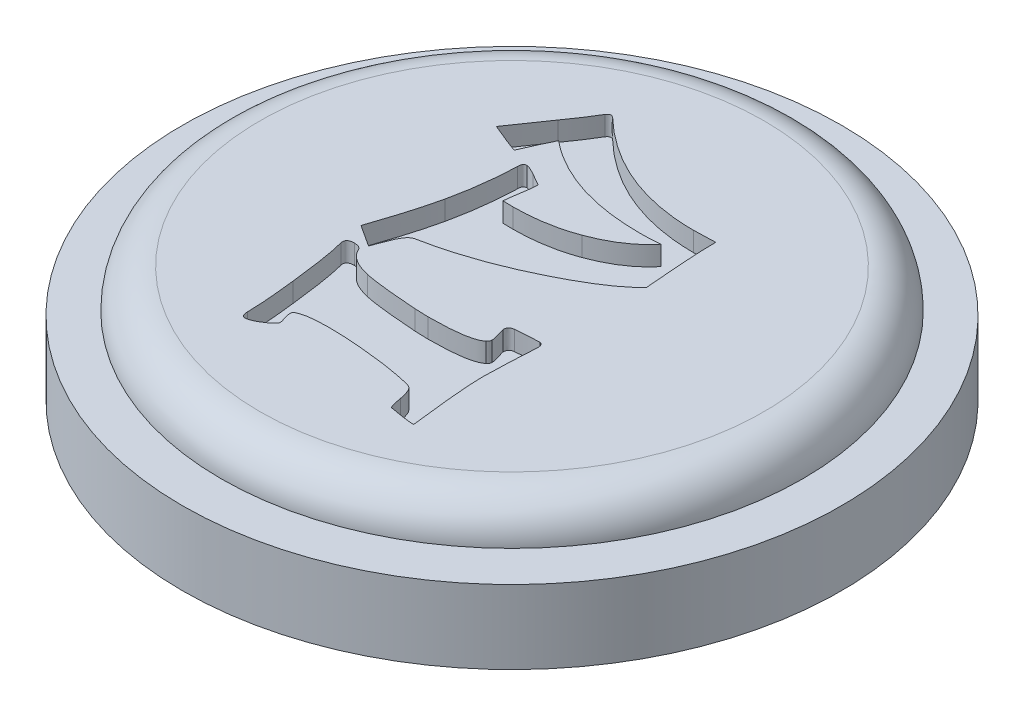
from build123d import *

# Parameters (mm, degrees)
SKETCH1_R           = 12.3
BOSS_EXTRUDE1_DEPTH = 4
SKETCH2_R           = 15
BOSS_EXTRUDE2_DEPTH = 2
CHAMFER1_SIZE       = 0.5
CHAMFER1_SIZE2      = 1.37373871
SKETCH4_R           = 16
SKETCH4_R_2         = 12.8
BOSS_EXTRUDE4_DEPTH = 3.6
FILLET1_R           = 2
CUT_EXTRUDE1_START  = -1
CUT_EXTRUDE1_DEPTH  = 1
SKETCH5_R           = 17
SKETCH5_R_2         = 13.3
BOSS_EXTRUDE5_DEPTH = 3.8


# Read off the part's stored shape, not the designer's step: Cut-Extrude1
with BuildPart() as part:
    # Sketch1 → Boss-Extrude1 (new body)
    with BuildSketch(Plane(origin=(0, 0, 0), x_dir=(1, 0, 0), z_dir=(0, 1, 0))):
        with Locations(Location((0, 0, 0), (0, 0, 270))):
            Circle(SKETCH1_R)
    extrude(amount=BOSS_EXTRUDE1_DEPTH)

    # Sketch2 → Boss-Extrude2 (add)
    with BuildSketch(Plane(origin=(0, 4, 0), x_dir=(1, 0, 0), z_dir=(0, 1, 0))):
        with Locations(Location((0, 0, 0), (0, 0, 270))):
            Circle(SKETCH2_R)
    extrude(amount=BOSS_EXTRUDE2_DEPTH)

    # Chamfer1
    chamfer1_edges = [part.edges().sort_by_distance(p)[0] for p in [
        (0, 0, -12.3),
    ]]
    chamfer1_side = [part.faces().sort_by_distance(p)[0] for p in [
        (0, 0, 0),
    ]]
    chamfer(chamfer1_edges, length=CHAMFER1_SIZE, length2=CHAMFER1_SIZE2, reference=chamfer1_side[0])

    # Fillet1
    fillet1_edges = [part.edges().sort_by_distance(p)[0] for p in [
        (0, 6, -15),
    ]]
    fillet(fillet1_edges, radius=FILLET1_R - 0.0001)  # a hair under: the kernel refuses the full size

    # Cut-Extrude1 outline → Cut-Extrude1 (cut)
    with BuildSketch(Plane(origin=(0, 6, 0), x_dir=(1, 0, 0), z_dir=(0, 1, 0)).offset(CUT_EXTRUDE1_START)):
        with BuildLine():
            add(Edge.make_bspline(
                [(2.881003751, -2.752911208), (3.001661354, -2.741591605), (3.231295855, -2.720048235), (3.55759474, -2.695693934), (3.847669077, -2.682942971), (4.028496236, -2.679784273), (4.1128087, -2.678311499)],
                knots=[0, 0, 0, 0, 0.294505446, 0.560500206, 0.795078845, 1, 1, 1, 1], degree=3))
            add(Edge.make_bspline(
                [(2.598980461, -3.051310044), (2.601892042, -3.010576786), (2.607324749, -2.934572771), (2.663465353, -2.834127629), (2.761830391, -2.771579045), (2.838830629, -2.75951739), (2.881003751, -2.752911208)],
                knots=[0, 0, 0, 0, 0.264788379, 0.494067532, 0.722900182, 1, 1, 1, 1], degree=3))
            add(Edge.make_bspline(
                [(2.786389486, -3.817321689), (2.785247921, -3.789346761), (2.782722007, -3.727447252), (2.762283461, -3.627925755), (2.733396505, -3.513119327), (2.694012176, -3.390810187), (2.655904598, -3.273675389), (2.627021829, -3.175380672), (2.607006365, -3.10468152), (2.601176485, -3.065913388), (2.598980461, -3.051310044)],
                knots=[0, 0, 0, 0, 0.106053365, 0.234661961, 0.384202293, 0.555208206, 0.7218246, 0.851396723, 0.944023487, 1, 1, 1, 1], degree=3))
            add(Edge.make_bspline(
                [(2.675399675, -4.015647744), (2.70786199, -3.984687529), (2.765698347, -3.929527383), (2.780079964, -3.851537508), (2.786389486, -3.817321689)],
                knots=[0, 0, 0, 0, 0.561278696, 1, 1, 1, 1], degree=3))
            add(Edge.make_bspline(
                [(0.091702441, -4.42503639), (0.25910651, -4.423384492), (0.577038055, -4.42024723), (1.028691827, -4.403885536), (1.429192979, -4.370583642), (1.778837259, -4.329557875), (2.077388488, -4.27269195), (2.323494502, -4.201788529), (2.524830315, -4.125745257), (2.628641621, -4.049837604), (2.675399675, -4.015647744)],
                knots=[0, 0, 0, 0, 0.189541194, 0.359974074, 0.511546566, 0.64441348, 0.758477424, 0.854968798, 0.934675933, 1, 1, 1, 1], degree=3))
            add(Edge.make_bspline(
                [(-0.59788999, -4.401382824), (-0.474805351, -4.408510004), (-0.245120695, -4.421809827), (-0.015068265, -4.424013591), (0.091702441, -4.42503639)],
                knots=[0, 0, 0, 0, 0.535885341, 1, 1, 1, 1], degree=3))
            add(Edge.make_bspline(
                [(-3.368996249, -4.084788937), (-3.313357802, -4.098894864), (-3.185485383, -4.131314152), (-2.965332908, -4.165636846), (-2.695716858, -4.206876752), (-2.374637366, -4.245820689), (-2.002904706, -4.286110571), (-1.579290394, -4.322903041), (-1.105715159, -4.363621585), (-0.772591158, -4.388392265), (-0.59788999, -4.401382824)],
                knots=[0, 0, 0, 0, 0.061653237, 0.141696055, 0.239217594, 0.354821433, 0.489201033, 0.641029359, 0.811744005, 1, 1, 1, 1], degree=3))
            add(Edge.make_bspline(
                [(-4.675400907, -3.26419214), (-4.65035264, -3.312553436), (-4.599837959, -3.410083353), (-4.491785781, -3.539854027), (-4.364421043, -3.661768236), (-4.208846624, -3.767325221), (-4.033959055, -3.86698803), (-3.833205442, -3.951601863), (-3.609814804, -4.025974884), (-3.451196426, -4.064713551), (-3.368996249, -4.084788937)],
                knots=[0, 0, 0, 0, 0.102065057, 0.205833946, 0.315482163, 0.432472068, 0.558004546, 0.693288222, 0.841053963, 1, 1, 1, 1], degree=3))
            add(Edge.make_bspline(
                [(-5.097526089, -3.027656477), (-5.048652774, -3.030064334), (-4.957088821, -3.034575444), (-4.831534074, -3.077808164), (-4.733420891, -3.156912741), (-4.69500808, -3.227938327), (-4.675400907, -3.26419214)],
                knots=[0, 0, 0, 0, 0.284392406, 0.532808, 0.761529718, 1, 1, 1, 1], degree=3))
            add(Edge.make_bspline(
                [(-5.459607603, -3.355167394), (-5.463054998, -3.329767341), (-5.469543319, -3.281962053), (-5.463329309, -3.212814496), (-5.438991475, -3.153814779), (-5.398395111, -3.106409827), (-5.343914731, -3.069364367), (-5.274588184, -3.044416324), (-5.190868036, -3.030614089), (-5.130334097, -3.028696025), (-5.097526089, -3.027656477)],
                knots=[0, 0, 0, 0, 0.131741991, 0.247950816, 0.352917975, 0.454869288, 0.56487117, 0.688400872, 0.831120413, 1, 1, 1, 1], degree=3))
            add(Edge.make_bspline(
                [(-4.984716773, -6.308224163), (-5.003792254, -6.144428402), (-5.040550562, -5.828795211), (-5.099100734, -5.372723587), (-5.156891853, -4.951728896), (-5.214689589, -4.564576843), (-5.274458994, -4.212785822), (-5.334704553, -3.89558441), (-5.393065766, -3.612912527), (-5.438351343, -3.437502025), (-5.459607603, -3.355167394)],
                knots=[0, 0, 0, 0, 0.16527492, 0.31848352, 0.460845698, 0.591174989, 0.71079668, 0.818452341, 0.914784695, 1, 1, 1, 1], degree=3))
            add(Edge.make_bspline(
                [(-4.782751708, -8.864628821), (-4.783691054, -8.793055999), (-4.785697706, -8.640160683), (-4.794879926, -8.396255277), (-4.81221185, -8.122170635), (-4.833942375, -7.817688154), (-4.860989732, -7.482803742), (-4.895904707, -7.118298675), (-4.938229599, -6.723568294), (-4.96883372, -6.450132832), (-4.984716773, -6.308224163)],
                knots=[0, 0, 0, 0, 0.083701485, 0.178804811, 0.285381045, 0.404835718, 0.535767461, 0.678252657, 0.83301823, 1, 1, 1, 1], degree=3))
            add(Edge.make_bspline(
                [(-4.573508622, -9.199417758), (-4.605277031, -9.195493362), (-4.667638644, -9.187789744), (-4.741386158, -9.112757623), (-4.778131917, -8.999997263), (-4.781085388, -8.913455079), (-4.782751708, -8.864628821)],
                knots=[0, 0, 0, 0, 0.211364709, 0.414910434, 0.669898164, 1, 1, 1, 1], degree=3))
            add(Edge.make_bspline(
                [(-3.467249524, -8.475254731), (-3.468915985, -8.490008021), (-3.472453142, -8.521322726), (-3.495300046, -8.568742476), (-3.53040511, -8.618797688), (-3.57776, -8.67404839), (-3.641577911, -8.729287282), (-3.715083671, -8.79224699), (-3.80584531, -8.854391544), (-3.935103215, -8.943875642), (-4.09702244, -9.03902317), (-4.276521615, -9.128601328), (-4.43262425, -9.184669614), (-4.53013484, -9.194877278), (-4.573508622, -9.199417758)],
                knots=[0, 0, 0, 0, 0.032229403, 0.068408758, 0.113231059, 0.165816983, 0.226763914, 0.297317821, 0.377081524, 0.466726126, 0.640741107, 0.786479442, 0.905023708, 1, 1, 1, 1], degree=3))
            add(Edge.make_bspline(
                [(-3.618268447, -7.834788937), (-3.61665676, -7.852401472), (-3.612800252, -7.894545429), (-3.599874615, -7.967181778), (-3.574752679, -8.058380755), (-3.544105671, -8.161811825), (-3.512124261, -8.264298374), (-3.488956846, -8.35297292), (-3.472463756, -8.420741073), (-3.46876249, -8.459437003), (-3.467249524, -8.475254731)],
                knots=[0, 0, 0, 0, 0.080451376, 0.192507176, 0.335067377, 0.510569865, 0.683427478, 0.823318736, 0.927778035, 1, 1, 1, 1], degree=3))
            add(Edge.make_bspline(
                [(-3.558224779, -7.691048035), (-3.567253185, -7.696526263), (-3.586907282, -7.708451915), (-3.606546297, -7.741583023), (-3.616617616, -7.785035983), (-3.617682569, -7.817131667), (-3.618268447, -7.834788937)],
                knots=[0, 0, 0, 0, 0.190545164, 0.414801129, 0.67805593, 1, 1, 1, 1], degree=3))
            add(Edge.make_bspline(
                [(-2.017103964, -7.452692868), (-2.106881472, -7.453318081), (-2.279835902, -7.454522543), (-2.528002665, -7.465652099), (-2.75467792, -7.482345977), (-2.958306435, -7.510924214), (-3.140836414, -7.540962589), (-3.299839027, -7.584831747), (-3.439590969, -7.628418205), (-3.520491306, -7.671127567), (-3.558224779, -7.691048035)],
                knots=[0, 0, 0, 0, 0.17117688, 0.329768563, 0.47363951, 0.604323439, 0.721831521, 0.825903215, 0.918797911, 1, 1, 1, 1], degree=3))
            add(Edge.make_bspline(
                [(1.039664595, -7.68558952), (0.895971073, -7.667010818), (0.613648635, -7.630508237), (0.196329167, -7.583210738), (-0.206436171, -7.54327584), (-0.595821826, -7.510093026), (-0.970704838, -7.484743901), (-1.332222975, -7.466382783), (-1.679207547, -7.454933584), (-1.906106023, -7.453428936), (-2.017103964, -7.452692868)],
                knots=[0, 0, 0, 0, 0.141687778, 0.278381645, 0.410696119, 0.537477972, 0.660531372, 0.778116023, 0.891455135, 1, 1, 1, 1], degree=3))
            add(Edge.make_bspline(
                [(2.748179879, -8.065866084), (2.729688804, -8.05375144), (2.681071963, -8.021899547), (2.577522803, -7.985048227), (2.430713571, -7.944842949), (2.239318088, -7.899870106), (2.003346649, -7.850807183), (1.722315921, -7.798920394), (1.396028004, -7.742345169), (1.163441223, -7.705302607), (1.039664595, -7.68558952)],
                knots=[0, 0, 0, 0, 0.037657184, 0.099008487, 0.186216267, 0.298004238, 0.43450404, 0.597822424, 0.785971566, 1, 1, 1, 1], degree=3))
            add(Edge.make_bspline(
                [(3.033842179, -8.797307132), (3.018011424, -8.714354269), (2.988679328, -8.56065462), (2.923291163, -8.355440497), (2.850842907, -8.1877438), (2.780372279, -8.104083701), (2.748179879, -8.065866084)],
                knots=[0, 0, 0, 0, 0.318086781, 0.589368758, 0.812415385, 1, 1, 1, 1], degree=3))
            add(Edge.make_bspline(
                [(3.217612193, -9.426855895), (3.210564808, -9.421113651), (3.192460575, -9.406362233), (3.173035093, -9.367846074), (3.151178165, -9.315139549), (3.130169548, -9.244628141), (3.10605428, -9.15756874), (3.083711462, -9.052126354), (3.057485084, -8.930495039), (3.042035257, -8.843461317), (3.033842179, -8.797307132)],
                knots=[0, 0, 0, 0, 0.040805156, 0.104825552, 0.190971929, 0.300353499, 0.436852968, 0.600004338, 0.787881375, 1, 1, 1, 1], degree=3))
            add(Edge.make_bspline(
                [(4.533114377, -9.6069869), (4.499753884, -9.605887418), (4.426313835, -9.60346701), (4.307222754, -9.596861887), (4.170248136, -9.581098722), (4.014982288, -9.561012395), (3.841470823, -9.535693376), (3.64928719, -9.504197887), (3.439347836, -9.468249264), (3.293389592, -9.441001938), (3.217612193, -9.426855895)],
                knots=[0, 0, 0, 0, 0.075342271, 0.165859062, 0.269113098, 0.386444574, 0.519254346, 0.664866343, 0.826008068, 1, 1, 1, 1], degree=3))
            add(Edge.make_bspline(
                [(4.183769398, -5.716885007), (4.184304683, -5.762979564), (4.185424673, -5.859424482), (4.188657224, -6.011101251), (4.196846638, -6.17662633), (4.205053462, -6.356240337), (4.218933553, -6.550220365), (4.232458485, -6.758372734), (4.251612268, -6.980236338), (4.270979476, -7.216276928), (4.295336126, -7.46603911), (4.320082697, -7.730607562), (4.35012005, -8.008837367), (4.380057463, -8.30134506), (4.415678529, -8.60744702), (4.451223667, -8.927847537), (4.491988701, -9.262480605), (4.519212619, -9.49053306), (4.533114377, -9.6069869)],
                knots=[0, 0, 0, 0, 0.035392518, 0.074052746, 0.116467878, 0.162626056, 0.212092542, 0.26577179, 0.322771699, 0.383058632, 0.447602928, 0.515436268, 0.587069333, 0.662455868, 0.741183897, 0.823665874, 0.909955865, 1, 1, 1, 1], degree=3))
            add(Edge.make_bspline(
                [(4.300217724, -2.994905386), (4.300347536, -3.005826447), (4.300722971, -3.037411839), (4.295126025, -3.098555106), (4.29352773, -3.189072857), (4.284180142, -3.307782267), (4.278861591, -3.455939476), (4.265978112, -3.632254166), (4.256883261, -3.83803161), (4.236058581, -4.143486065), (4.216614276, -4.525001251), (4.197888054, -4.959256748), (4.186237158, -5.351706704), (4.184560463, -5.599823517), (4.183769398, -5.716885007)],
                knots=[0, 0, 0, 0, 0.012019317, 0.034761717, 0.067508213, 0.111659907, 0.165812744, 0.230707301, 0.306268195, 0.392572117, 0.567769545, 0.726831848, 0.87111929, 1, 1, 1, 1], degree=3))
            add(Edge.make_bspline(
                [(4.1128087, -2.678311499), (4.141553989, -2.68182813), (4.198380551, -2.688780158), (4.263605284, -2.76080171), (4.296865489, -2.866467934), (4.299006507, -2.94849883), (4.300217724, -2.994905386)],
                knots=[0, 0, 0, 0, 0.204669926, 0.40461198, 0.663176816, 1, 1, 1, 1], degree=3))
        make_face()
        with BuildLine():
            add(Edge.make_bspline(
                [(-4.384280092, 9.177583697), (-4.361546359, 9.207997222), (-4.320715716, 9.26262106), (-4.234496337, 9.3133397), (-4.138587164, 9.304926785), (-4.08814189, 9.269719883), (-4.060408185, 9.250363901)],
                knots=[0, 0, 0, 0, 0.293932381, 0.527913652, 0.740457288, 1, 1, 1, 1], degree=3))
            add(Edge.make_bspline(
                [(-5.344978782, 7.721979622), (-5.256070168, 7.847879537), (-5.081769088, 8.094700291), (-4.831270387, 8.462344227), (-4.600856521, 8.822363103), (-4.455433719, 9.060880167), (-4.384280092, 9.177583697)],
                knots=[0, 0, 0, 0, 0.265047675, 0.519613274, 0.764952555, 1, 1, 1, 1], degree=3))
            add(Edge.make_bspline(
                [(-6.645924925, 5.842430859), (-6.567054558, 5.957042312), (-6.416467726, 6.175869436), (-6.201711115, 6.488788013), (-6.008785047, 6.771184099), (-5.836905579, 7.022350739), (-5.682446156, 7.240354224), (-5.553088272, 7.429944536), (-5.441355732, 7.586083914), (-5.374670857, 7.680112499), (-5.344978782, 7.721979622)],
                knots=[0, 0, 0, 0, 0.182589344, 0.348617, 0.498083269, 0.631438282, 0.748030687, 0.848713623, 0.9326383, 1, 1, 1, 1], degree=3))
            add(Edge.make_bspline(
                [(-5.128457676, 5.240174672), (-5.176419945, 5.257022282), (-5.277427765, 5.292503096), (-5.434286309, 5.3507535), (-5.605264182, 5.414241902), (-5.787671071, 5.487768747), (-5.984673037, 5.565373903), (-6.193802493, 5.65119901), (-6.415825528, 5.743905343), (-6.567737477, 5.808952028), (-6.645924925, 5.842430859)],
                knots=[0, 0, 0, 0, 0.093391697, 0.196681515, 0.30740294, 0.428447286, 0.557974491, 0.696402621, 0.84374169, 1, 1, 1, 1], degree=3))
            add(Edge.make_bspline(
                [(-4.739083586, 6.111717613), (-4.799095654, 5.971937464), (-4.924636974, 5.679526537), (-5.05855566, 5.390854073), (-5.128457676, 5.240174672)],
                knots=[0, 0, 0, 0, 0.478026419, 1, 1, 1, 1], degree=3))
            add(Edge.make_bspline(
                [(-4.407933658, 6.812227074), (-4.428040662, 6.772244079), (-4.4744721, 6.679914662), (-4.55023163, 6.52306635), (-4.638979219, 6.328829366), (-4.703859048, 6.188114492), (-4.739083586, 6.111717613)],
                knots=[0, 0, 0, 0, 0.17326388, 0.400103926, 0.674304598, 1, 1, 1, 1], degree=3))
            add(Edge.make_bspline(
                [(1.823871291, 4.774381368), (1.669164732, 4.7753359), (1.363171791, 4.777223861), (0.909464679, 4.805682404), (0.465409456, 4.841037171), (0.031815319, 4.899485265), (-0.393045131, 4.968458209), (-0.806834373, 5.059585158), (-1.212691472, 5.159571517), (-1.606576048, 5.281043834), (-1.992431174, 5.414459473), (-2.36612346, 5.569267582), (-2.733427931, 5.732834397), (-3.087443656, 5.918025578), (-3.433711732, 6.116421089), (-3.768055798, 6.333438197), (-4.096591669, 6.561388537), (-4.303970746, 6.728467396), (-4.407933658, 6.812227074)],
                knots=[0, 0, 0, 0, 0.069340272, 0.137147603, 0.203733815, 0.268990051, 0.333221534, 0.396627701, 0.458877857, 0.520546376, 0.581340822, 0.641827459, 0.701817083, 0.761525088, 0.820845551, 0.88065252, 0.940168933, 1, 1, 1, 1], degree=3))
            add(Edge.make_bspline(
                [(2.854207741, 4.822463919), (2.815882158, 4.817468017), (2.690617051, 4.802320353), (2.463246681, 4.789649878), (2.15821494, 4.775184666), (1.940346711, 4.774661213), (1.823871291, 4.774381368)],
                knots=[0.090181309, 0.090181309, 0.090181309, 0.090181309, 0.192385139, 0.423915884, 0.692017327, 1, 1, 1, 1], degree=3))
            add(Edge.make_bspline(
                [(0.410115832, 3.189592431), (0.54247781, 3.239972779), (0.801933379, 3.338728194), (1.170192249, 3.513843569), (1.517079731, 3.696398498), (1.836595845, 3.897144178), (2.134105374, 4.109953287), (2.403663054, 4.339860474), (2.647578368, 4.573576478), (2.787696886, 4.741913088), (2.854207741, 4.822463919)],
                knots=[0, 0, 0, 0, 0.141555377, 0.277476444, 0.407433029, 0.533298202, 0.654484596, 0.772821242, 0.887322846, 0.991692174, 0.991692174, 0.991692174, 0.991692174], degree=3))
            add(Edge.make_bspline(
                [(-2.621179655, 2.678311499), (-2.485277277, 2.679348306), (-2.216256059, 2.681400682), (-1.816936857, 2.708742411), (-1.426081186, 2.74837579), (-1.042611136, 2.801882553), (-0.667855089, 2.875947342), (-0.30024269, 2.962451508), (0.059468251, 3.06578197), (0.293444454, 3.148396832), (0.410115832, 3.189592431)],
                knots=[0, 0, 0, 0, 0.131920492, 0.261139, 0.388399989, 0.513311157, 0.636877144, 0.759134203, 0.879893151, 1, 1, 1, 1], degree=3))
            add(Edge.make_bspline(
                [(-3.152050103, 2.686045608), (-3.077598918, 2.683663182), (-2.900687559, 2.678355831), (-2.723688273, 2.678327758), (-2.621179655, 2.678311499)],
                knots=[0.073777583, 0.073777583, 0.073777583, 0.073777583, 0.463581002, 1, 1, 1, 1], degree=3))
            add(Edge.make_bspline(
                [(-3.068777909, 3.36790393), (-3.081351412, 3.289118509), (-3.104145939, 3.146288281), (-3.129094678, 2.952056035), (-3.147345297, 2.803720129), (-3.150799628, 2.719283201), (-3.152050103, 2.686045608)],
                knots=[0, 0, 0, 0, 0.342520643, 0.620956272, 0.840955698, 0.983717111, 0.983717111, 0.983717111, 0.983717111], degree=3))
            add(Edge.make_bspline(
                [(-2.954149088, 4.303129549), (-2.958055634, 4.242453773), (-2.966623143, 4.109384785), (-2.98860936, 3.892603237), (-3.024145842, 3.64161745), (-3.053260369, 3.463067805), (-3.068777909, 3.36790393)],
                knots=[0, 0, 0, 0, 0.193474769, 0.424312525, 0.693168528, 1, 1, 1, 1], degree=3))
            add(Edge.make_bspline(
                [(-3.581878345, 4.661572052), (-3.51150105, 4.620370157), (-3.382953362, 4.54511281), (-3.208559712, 4.442284215), (-3.069410479, 4.364438123), (-2.988167357, 4.321224173), (-2.954149088, 4.303129549)],
                knots=[0, 0, 0, 0, 0.338418804, 0.618139059, 0.840106484, 1, 1, 1, 1], degree=3))
            add(Edge.make_bspline(
                [(-4.111354328, 4.890829694), (-4.085075688, 4.886764821), (-4.018501681, 4.876466917), (-3.904099971, 4.830054952), (-3.755141167, 4.755426139), (-3.644172497, 4.695315937), (-3.581878345, 4.661572052)],
                knots=[0, 0, 0, 0, 0.137192843, 0.347562789, 0.633743268, 1, 1, 1, 1], degree=3))
            add(Edge.make_bspline(
                [(-4.315138899, 4.596069869), (-4.313351887, 4.639427576), (-4.310183386, 4.716303971), (-4.274223562, 4.817385003), (-4.20170649, 4.882613015), (-4.142278103, 4.888017468), (-4.111354328, 4.890829694)],
                knots=[0, 0, 0, 0, 0.320495154, 0.568261423, 0.775343276, 1, 1, 1, 1], degree=3))
            add(Edge.make_bspline(
                [(-4.72998606, 1.271834061), (-4.673820054, 1.543653859), (-4.561319272, 2.088110238), (-4.442735891, 2.915716415), (-4.353812281, 3.752005944), (-4.328070067, 4.313841326), (-4.315138899, 4.596069869)],
                knots=[0, 0, 0, 0, 0.248180649, 0.497107049, 0.747380194, 1, 1, 1, 1], degree=3))
            add(Edge.make_bspline(
                [(-5.714338316, -2.076055313), (-5.658928014, -1.911767082), (-5.550497142, -1.590276034), (-5.395591373, -1.118859139), (-5.255459725, -0.667814888), (-5.12677512, -0.238861979), (-5.006662915, 0.168501663), (-4.904841706, 0.555731968), (-4.809998994, 0.920230668), (-4.75610317, 1.157066812), (-4.72998606, 1.271834061)],
                knots=[0, 0, 0, 0, 0.148986065, 0.291546666, 0.426384734, 0.554825481, 0.676382376, 0.791296841, 0.898865574, 1, 1, 1, 1], degree=3))
            Line((-5.714338316, -2.076055313), (-4.606259714, -2.794759825))
            add(Edge.make_bspline(
                [(-4.231441664, -1.83588064), (-4.289065838, -1.988953332), (-4.409980647, -2.31015109), (-4.538820736, -2.628254459), (-4.606259714, -2.794759825)],
                knots=[0, 0, 0, 0, 0.476568367, 1, 1, 1, 1], degree=3))
            add(Edge.make_bspline(
                [(-3.732897268, -1.279112082), (-3.755055349, -1.284923063), (-3.801174624, -1.297017894), (-3.866404234, -1.333250895), (-3.931134987, -1.381643495), (-3.995400189, -1.444108199), (-4.056080927, -1.522847947), (-4.11577475, -1.614697817), (-4.177180905, -1.718851589), (-4.212717841, -1.795497291), (-4.231441664, -1.83588064)],
                knots=[0, 0, 0, 0, 0.088637937, 0.184488788, 0.287154583, 0.402053098, 0.531132503, 0.672198209, 0.827286671, 1, 1, 1, 1], degree=3))
            add(Edge.make_bspline(
                [(1.305312339, 0.462154294), (1.091774823, 0.359079931), (0.668653428, 0.154839622), (0.029865324, -0.128090775), (-0.607235103, -0.381228792), (-1.238399632, -0.614395865), (-1.86727916, -0.817263644), (-2.491348398, -0.998065256), (-3.111989568, -1.154201398), (-3.526934768, -1.237677716), (-3.732897268, -1.279112082)],
                knots=[0, 0, 0, 0, 0.133034474, 0.263605822, 0.391883966, 0.517626554, 0.641059876, 0.762545684, 0.882137004, 1, 1, 1, 1], degree=3))
            add(Edge.make_bspline(
                [(4.416666051, 2.525473071), (4.339726176, 2.444662616), (4.177357867, 2.274126115), (3.893673654, 2.033594357), (3.572072048, 1.780785178), (3.202706663, 1.527859782), (2.79118639, 1.267573521), (2.335002128, 1.003043862), (1.837362853, 0.729157577), (1.486666063, 0.553164524), (1.305312339, 0.462154294)],
                knots=[0, 0, 0, 0, 0.089160331, 0.188157471, 0.29700019, 0.416188408, 0.545885252, 0.686284228, 0.837770047, 1, 1, 1, 1], degree=3))
            add(Edge.make_bspline(
                [(4.183769398, 6.322780204), (4.184571609, 6.21784798), (4.186292317, 5.992772816), (4.198128618, 5.632475561), (4.216508013, 5.226102602), (4.24212016, 4.774239157), (4.275231528, 4.276307616), (4.315252652, 3.733474308), (4.362763594, 3.144565031), (4.398238386, 2.7371224), (4.416666051, 2.525473071)],
                knots=[0, 0, 0, 0, 0.082723155, 0.177437655, 0.284169263, 0.403413305, 0.534228012, 0.677577313, 0.832514961, 1, 1, 1, 1], degree=3))
            add(Edge.make_bspline(
                [(3.081149311, 6.288209607), (3.259498025, 6.290039053), (3.627277817, 6.293811626), (3.994582852, 6.312931959), (4.183769398, 6.322780204)],
                knots=[0, 0, 0, 0, 0.484933425, 1, 1, 1, 1], degree=3))
            add(Edge.make_bspline(
                [(-4.060408185, 9.250363901), (-3.931556678, 9.129849622), (-3.676047145, 8.890872619), (-3.279562194, 8.553594572), (-2.872754085, 8.243354522), (-2.460878072, 7.952516295), (-2.041421702, 7.68468213), (-1.612330467, 7.442931301), (-1.177543698, 7.222039647), (-0.734416844, 7.024700191), (-0.283121022, 6.852954605), (0.174698775, 6.700449522), (0.640672975, 6.573344253), (1.114542575, 6.470077838), (1.595262445, 6.387497797), (2.08353515, 6.329819148), (2.579633902, 6.293956788), (2.913087418, 6.290135534), (3.081149311, 6.288209607)],
                knots=[0, 0, 0, 0, 0.066702166, 0.132268839, 0.19671143, 0.260078898, 0.322868203, 0.384790547, 0.446221774, 0.507202355, 0.568103546, 0.628728224, 0.689589249, 0.750628443, 0.812042119, 0.873936431, 0.936463461, 1, 1, 1, 1], degree=3))
        make_face()
    extrude(amount=CUT_EXTRUDE1_DEPTH, mode=Mode.SUBTRACT)


with BuildPart() as body_2:
    # Sketch4 → Boss-Extrude4 (new body)
    with BuildSketch(Plane.XZ):
        with Locations(Location((0, 0, 0), (0, 0, 270))):
            Circle(SKETCH4_R)
        with Locations(Location((0, 0, 0), (0, 0, 270))):
            Circle(SKETCH4_R_2, mode=Mode.SUBTRACT)
    extrude(amount=-BOSS_EXTRUDE4_DEPTH)


with BuildPart() as body_3:
    # Sketch5 → Boss-Extrude5 (new body)
    with BuildSketch(Plane.XZ):
        with Locations(Location((0, 0, 0), (0, 0, 270))):
            Circle(SKETCH5_R)
        with Locations(Location((0, 0, 0), (0, 0, 270))):
            Circle(SKETCH5_R_2, mode=Mode.SUBTRACT)
    extrude(amount=-BOSS_EXTRUDE5_DEPTH)


solid = Compound([part.part, body_2.part, body_3.part])
